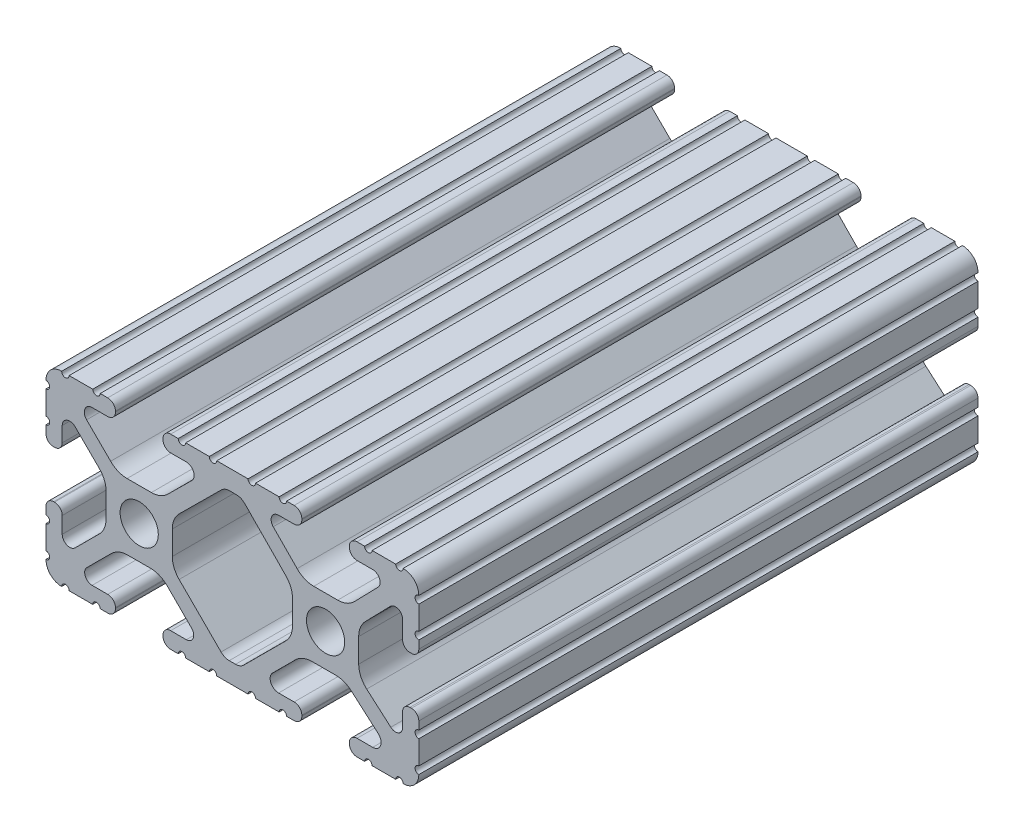
from build123d import *

# Parameters (mm, degrees)
SKETCH1_R      = 2.6035
EXTRUDE1_DEPTH = 76.2


with BuildPart() as part:
    # Sketch1 → Extrude1 (new body)
    with BuildSketch(Plane.XY):
        with BuildLine():
            Line((22.2504, 12.7), (19.03310265, 12.7))
            ThreePointArc((19.03310265, 12.7), (18.52510265, 12.192), (18.01710265, 12.7))
            Line((18.01710265, 12.7), (16.98745015, 12.7))
            ThreePointArc((16.98745015, 12.7), (16.245730386, 12.392769614), (15.9385, 11.65104985))
            Line((15.9385, 11.65104985), (15.9385, 11.53922))
            ThreePointArc((15.9385, 11.53922), (16.245750844, 10.797450844), (16.98752, 10.4902))
            Line((16.98752, 10.4902), (19.116384363, 10.4902))
            ThreePointArc((19.116384363, 10.4902), (20.052502933, 9.869096983), (19.844087081, 8.765172272))
            Line((19.844087081, 8.765172272), (16.618993479, 5.455112286))
            ThreePointArc((16.618993479, 5.455112286), (15.578994274, 4.745442459), (14.344932584, 4.4958))
            Line((14.344932584, 4.4958), (11.083317835, 4.4958))
            ThreePointArc((11.083317835, 4.4958), (9.854330953, 4.743306833), (8.816955189, 5.447238587))
            Line((8.816955189, 5.447238587), (5.564154119, 8.762652677))
            ThreePointArc((5.564154119, 8.762652677), (5.352591412, 9.867473037), (6.289393385, 10.4902))
            Line((6.289393385, 10.4902), (8.41248, 10.4902))
            ThreePointArc((8.41248, 10.4902), (9.154249156, 10.797450844), (9.4615, 11.53922))
            Line((9.4615, 11.53922), (9.4615, 11.65104985))
            ThreePointArc((9.4615, 11.65104985), (9.154269614, 12.392769614), (8.41254985, 12.7))
            Line((8.41254985, 12.7), (7.38288465, 12.7))
            ThreePointArc((7.38288465, 12.7), (6.87488465, 12.192), (6.36688465, 12.7))
            Line((6.36688465, 12.7), (3.14958095, 12.7))
            ThreePointArc((3.14958095, 12.7), (2.64158095, 12.192), (2.13358095, 12.7))
            Line((2.13358095, 12.7), (-2.13358095, 12.7))
            ThreePointArc((-2.13358095, 12.7), (-2.64158095, 12.192), (-3.14958095, 12.7))
            Line((-3.14958095, 12.7), (-6.36689735, 12.7))
            ThreePointArc((-6.36689735, 12.7), (-6.87489735, 12.192), (-7.38289735, 12.7))
            Line((-7.38289735, 12.7), (-8.41254985, 12.7))
            ThreePointArc((-8.41254985, 12.7), (-9.154269614, 12.392769614), (-9.4615, 11.65104985))
            Line((-9.4615, 11.65104985), (-9.4615, 11.53922))
            ThreePointArc((-9.4615, 11.53922), (-9.154249156, 10.797450844), (-8.41248, 10.4902))
            Line((-8.41248, 10.4902), (-6.283641037, 10.4902))
            ThreePointArc((-6.283641037, 10.4902), (-5.297291557, 9.829633109), (-5.532576693, 8.666071843))
            Line((-5.532576693, 8.666071843), (-8.809985098, 5.416263103))
            ThreePointArc((-8.809985098, 5.416263103), (-9.836720513, 4.734920264), (-11.045536121, 4.4958))
            Line((-11.045536121, 4.4958), (-14.354463879, 4.4958))
            ThreePointArc((-14.354463879, 4.4958), (-15.563279487, 4.734920264), (-16.590014902, 5.416263103))
            Line((-16.590014902, 5.416263103), (-19.867423307, 8.666071843))
            ThreePointArc((-19.867423307, 8.666071843), (-20.102708443, 9.829633109), (-19.116358963, 10.4902))
            Line((-19.116358963, 10.4902), (-16.98752, 10.4902))
            ThreePointArc((-16.98752, 10.4902), (-16.245750844, 10.797450844), (-15.9385, 11.53922))
            Line((-15.9385, 11.53922), (-15.9385, 11.65104985))
            ThreePointArc((-15.9385, 11.65104985), (-16.245730386, 12.392769614), (-16.98745015, 12.7))
            Line((-16.98745015, 12.7), (-18.01711535, 12.7))
            ThreePointArc((-18.01711535, 12.7), (-18.52511535, 12.192), (-19.03311535, 12.7))
            Line((-19.03311535, 12.7), (-22.2504, 12.7))
            ThreePointArc((-22.2504, 12.7), (-22.758323491, 12.192000006), (-23.266399977, 12.699846982))
            ThreePointArc((-23.266399977, 12.699846982), (-24.782522516, 12.082522516), (-25.399846982, 10.566399977))
            ThreePointArc((-25.399846982, 10.566399977), (-24.892000006, 10.058323491), (-25.4, 9.5504))
            Line((-25.4, 9.5504), (-25.4, 6.3330836))
            ThreePointArc((-25.4, 6.3330836), (-24.892, 5.8250836), (-25.4, 5.3170836))
            Line((-25.4, 5.3170836), (-25.4, 4.237520184))
            ThreePointArc((-25.4, 4.237520184), (-25.107393763, 3.531106237), (-24.400979816, 3.2385))
            Line((-24.400979816, 3.2385), (-24.23922, 3.2385))
            ThreePointArc((-24.23922, 3.2385), (-23.497450844, 3.545750844), (-23.1902, 4.28752))
            Line((-23.1902, 4.28752), (-23.1902, 6.334741132))
            ThreePointArc((-23.1902, 6.334741132), (-22.556026952, 7.286023527), (-21.434002553, 7.066535717))
            Line((-21.434002553, 7.066535717), (-18.147950853, 3.808156468))
            ThreePointArc((-18.147950853, 3.808156468), (-17.452759693, 2.774838327), (-17.208501877, 1.553619571))
            Line((-17.208501877, 1.553619571), (-17.208501877, -1.695179196))
            ThreePointArc((-17.208501877, -1.695179196), (-17.450738657, -2.911536421), (-18.140486065, -3.942289578))
            Line((-18.140486065, -3.942289578), (-21.431579576, -7.227386226))
            ThreePointArc((-21.431579576, -7.227386226), (-22.55444896, -7.449940594), (-23.1902, -6.498002195))
            Line((-23.1902, -6.498002195), (-23.1902, -4.28752))
            ThreePointArc((-23.1902, -4.28752), (-23.497450844, -3.545750844), (-24.23922, -3.2385))
            Line((-24.23922, -3.2385), (-24.35098, -3.2385))
            ThreePointArc((-24.35098, -3.2385), (-25.092749156, -3.545750844), (-25.4, -4.28752))
            Line((-25.4, -4.28752), (-25.4, -5.3171344))
            ThreePointArc((-25.4, -5.3171344), (-24.892, -5.8251344), (-25.4, -6.3331344))
            Line((-25.4, -6.3331344), (-25.4, -9.5504))
            ThreePointArc((-25.4, -9.5504), (-24.892000006, -10.058323491), (-25.399846982, -10.566399977))
            ThreePointArc((-25.399846982, -10.566399977), (-24.782522516, -12.082522516), (-23.266399977, -12.699846982))
            ThreePointArc((-23.266399977, -12.699846982), (-22.758323491, -12.192000006), (-22.2504, -12.7))
            Line((-22.2504, -12.7), (-19.03308995, -12.7))
            ThreePointArc((-19.03308995, -12.7), (-18.52508995, -12.192), (-18.01708995, -12.7))
            Line((-18.01708995, -12.7), (-16.9874692, -12.7))
            ThreePointArc((-16.9874692, -12.7), (-16.245700044, -12.392749156), (-15.9384492, -11.65098))
            Line((-15.9384492, -11.65098), (-15.9384492, -11.53922))
            ThreePointArc((-15.9384492, -11.53922), (-16.245700044, -10.797450844), (-16.9874692, -10.4902))
            Line((-16.9874692, -10.4902), (-19.116358963, -10.4902))
            ThreePointArc((-19.116358963, -10.4902), (-20.055197748, -9.862578342), (-19.834124023, -8.755124678))
            Line((-19.834124023, -8.755124678), (-16.49660751, -5.423689618))
            ThreePointArc((-16.49660751, -5.423689618), (-15.467274017, -4.736928798), (-14.253591699, -4.4958))
            Line((-14.253591699, -4.4958), (-11.146408301, -4.4958))
            ThreePointArc((-11.146408301, -4.4958), (-9.932725983, -4.736928798), (-8.90339249, -5.423689618))
            Line((-8.90339249, -5.423689618), (-5.565875977, -8.755124678))
            ThreePointArc((-5.565875977, -8.755124678), (-5.344802252, -9.862578342), (-6.283641037, -10.4902))
            Line((-6.283641037, -10.4902), (-8.4125308, -10.4902))
            ThreePointArc((-8.4125308, -10.4902), (-9.154299956, -10.797450844), (-9.4615508, -11.53922))
            Line((-9.4615508, -11.53922), (-9.4615508, -11.65098))
            ThreePointArc((-9.4615508, -11.65098), (-9.154299956, -12.392749156), (-8.4125308, -12.7))
            Line((-8.4125308, -12.7), (-7.38287195, -12.7))
            ThreePointArc((-7.38287195, -12.7), (-6.87487195, -12.192), (-6.36687195, -12.7))
            Line((-6.36687195, -12.7), (-3.14960635, -12.7))
            ThreePointArc((-3.14960635, -12.7), (-2.64160635, -12.192), (-2.13360635, -12.7))
            Line((-2.13360635, -12.7), (2.13360635, -12.7))
            ThreePointArc((2.13360635, -12.7), (2.64159365, -12.1920127), (3.14958095, -12.7))
            Line((3.14958095, -12.7), (6.36691005, -12.7))
            ThreePointArc((6.36691005, -12.7), (6.87491005, -12.192), (7.38291005, -12.7))
            Line((7.38291005, -12.7), (8.4125308, -12.7))
            ThreePointArc((8.4125308, -12.7), (9.154299956, -12.392749156), (9.4615508, -11.65098))
            Line((9.4615508, -11.65098), (9.4615508, -11.53922))
            ThreePointArc((9.4615508, -11.53922), (9.154299956, -10.797450844), (8.4125308, -10.4902))
            Line((8.4125308, -10.4902), (6.289393385, -10.4902))
            ThreePointArc((6.289393385, -10.4902), (5.231590322, -9.783049717), (5.480677245, -8.535265862))
            Line((5.480677245, -8.535265862), (8.597933595, -5.423689618))
            ThreePointArc((8.597933595, -5.423689618), (9.627267088, -4.736928798), (10.840949406, -4.4958))
            Line((10.840949406, -4.4958), (14.102564155, -4.4958))
            ThreePointArc((14.102564155, -4.4958), (15.215927525, -4.697410182), (16.187895372, -5.276636531))
            Line((16.187895372, -5.276636531), (19.868247549, -8.482246082))
            ThreePointArc((19.868247549, -8.482246082), (20.188435806, -9.746879864), (19.116384363, -10.4902))
            Line((19.116384363, -10.4902), (16.9874692, -10.4902))
            ThreePointArc((16.9874692, -10.4902), (16.245700044, -10.797450844), (15.9384492, -11.53922))
            Line((15.9384492, -11.53922), (15.9384492, -11.65098))
            ThreePointArc((15.9384492, -11.65098), (16.245700044, -12.392749156), (16.9874692, -12.7))
            Line((16.9874692, -12.7), (18.01710265, -12.7))
            ThreePointArc((18.01710265, -12.7), (18.52510265, -12.192), (19.03310265, -12.7))
            Line((19.03310265, -12.7), (22.2504, -12.7))
            ThreePointArc((22.2504, -12.7), (22.758323491, -12.192000006), (23.266399977, -12.699846982))
            ThreePointArc((23.266399977, -12.699846982), (24.782522516, -12.082522516), (25.399846982, -10.566399977))
            ThreePointArc((25.399846982, -10.566399977), (24.892000006, -10.058323492), (25.4, -9.550400001))
            Line((25.4, -9.550400001), (25.4, -6.333083592))
            ThreePointArc((25.4, -6.333083592), (24.892000001, -5.825083593), (25.4, -5.317083593))
            Line((25.4, -5.317083593), (25.4, -4.237520184))
            ThreePointArc((25.4, -4.237520184), (25.107393763, -3.531106237), (24.400979816, -3.2385))
            Line((24.400979816, -3.2385), (24.189220184, -3.2385))
            ThreePointArc((24.189220184, -3.2385), (23.482806237, -3.531106237), (23.1902, -4.237520184))
            Line((23.1902, -4.237520184), (23.1902, -6.155876159))
            ThreePointArc((23.1902, -6.155876159), (22.62232736, -7.038258539), (21.583974541, -6.886926384))
            Line((21.583974541, -6.886926384), (18.29817066, -4.024970844))
            ThreePointArc((18.29817066, -4.024970844), (17.493730985, -2.946044689), (17.208501877, -1.630807374))
            Line((17.208501877, -1.630807374), (17.208501877, 1.630807374))
            ThreePointArc((17.208501877, 1.630807374), (17.442348332, 2.82673414), (18.109440981, 3.846495088))
            Line((18.109440981, 3.846495088), (21.526346532, 7.353420386))
            ThreePointArc((21.526346532, 7.353420386), (22.585896263, 7.574939077), (23.1902, 6.676867167))
            Line((23.1902, 6.676867167), (23.1902, 4.237520184))
            ThreePointArc((23.1902, 4.237520184), (23.482806237, 3.531106237), (24.189220184, 3.2385))
            Line((24.189220184, 3.2385), (24.400979816, 3.2385))
            ThreePointArc((24.400979816, 3.2385), (25.107393763, 3.531106237), (25.4, 4.237520184))
            Line((25.4, 4.237520184), (25.4, 5.3170836))
            ThreePointArc((25.4, 5.3170836), (24.891949193, 5.825134407), (25.4, 6.333185215))
            Line((25.4, 6.333185215), (25.4, 9.550400015))
            ThreePointArc((25.4, 9.550400015), (24.892000013, 10.058323498), (25.399846982, 10.566399977))
            ThreePointArc((25.399846982, 10.566399977), (24.782522516, 12.082522516), (23.266399977, 12.699846982))
            ThreePointArc((23.266399977, 12.699846982), (22.758323491, 12.192000006), (22.2504, 12.7))
        make_face()
        with Locations((-12.7, 0)):
            Circle(SKETCH1_R, mode=Mode.SUBTRACT)
        with Locations((12.7, 0)):
            Circle(SKETCH1_R, mode=Mode.SUBTRACT)
        with BuildLine():
            Line((-7.259513935, -3.869413038), (-1.545748891, -9.572766749))
            ThreePointArc((-1.545748891, -9.572766749), (-1.035199478, -9.913400116), (-0.433213048, -10.033))
            Line((-0.433213048, -10.033), (0.433213048, -10.033))
            ThreePointArc((0.433213048, -10.033), (1.035199478, -9.913400116), (1.545748891, -9.572766749))
            Line((1.545748891, -9.572766749), (7.259513935, -3.869413038))
            ThreePointArc((7.259513935, -3.869413038), (7.949261343, -2.838659881), (8.191498123, -1.622302656))
            Line((8.191498123, -1.622302656), (8.191498123, 1.622302656))
            ThreePointArc((8.191498123, 1.622302656), (7.955573352, 2.823327967), (7.282860769, 3.845864069))
            Line((7.282860769, 3.845864069), (1.675572808, 9.561086461))
            ThreePointArc((1.675572808, 9.561086461), (1.161034429, 9.910236611), (0.551456936, 10.033))
            Line((0.551456936, 10.033), (-0.395199982, 10.033))
            ThreePointArc((-0.395199982, 10.033), (-0.994772524, 9.914396349), (-1.50403329, 9.576450301))
            Line((-1.50403329, 9.576450301), (-7.252049147, 3.876839553))
            ThreePointArc((-7.252049147, 3.876839553), (-7.947240307, 2.843521412), (-8.191498123, 1.622302656))
            Line((-8.191498123, 1.622302656), (-8.191498123, -1.622302656))
            ThreePointArc((-8.191498123, -1.622302656), (-7.949261343, -2.838659881), (-7.259513935, -3.869413038))
        make_face(mode=Mode.SUBTRACT)
    extrude(amount=-EXTRUDE1_DEPTH)


solid = part.part
